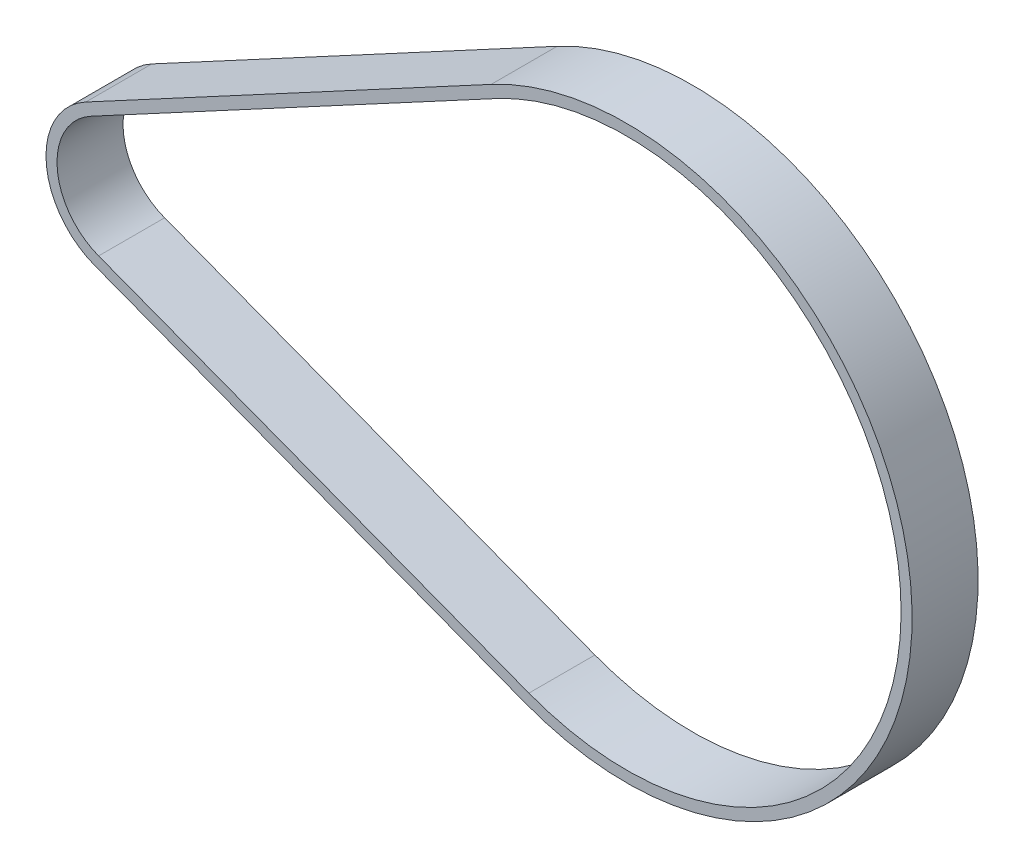
from build123d import *

# Parameters (mm, degrees)
EXTRUDE_THIN1_START = -1
EXTRUDE_THIN1_DEPTH = 6


with BuildPart() as part:
    # Sketch2 → Extrude-Thin1 (new body)
    with BuildSketch(Plane.XY.offset(EXTRUDE_THIN1_START)):
        with BuildLine():
            Line((-3.156917352, 2.547014688), (33.695464656, 22.363618757))
            ThreePointArc((33.695464656, 22.363618757), (71.902398785, 1.185603667), (36.771000527, -24.777119516))
            Line((36.771000527, -24.777119516), (-2.343762961, -9.916731441))
            ThreePointArc((-2.343762961, -9.916731441), (-6.75609114, -3.946199867), (-3.156917352, 2.547014688))
        make_face()
        with BuildLine():
            Line((-2.683317588, 1.666274509), (34.16906442, 21.482878578))
            ThreePointArc((34.16906442, 21.482878578), (70.904520247, 1.120500503), (37.126150999, -23.842310369))
            Line((37.126150999, -23.842310369), (-1.988612489, -8.981922293))
            ThreePointArc((-1.988612489, -8.981922293), (-5.758212601, -3.881096703), (-2.683317588, 1.666274509))
        make_face(mode=Mode.SUBTRACT)
    extrude(amount=-EXTRUDE_THIN1_DEPTH)


solid = part.part
